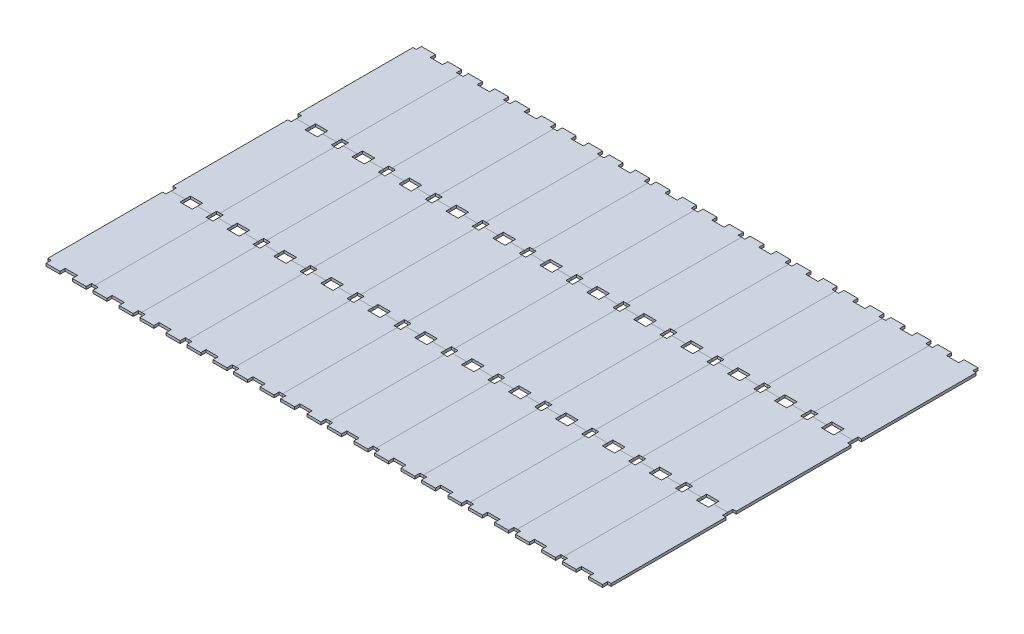
from build123d import *

# Parameters (mm, degrees)
SKETCH1_W           = 57.15
SKETCH1_H           = 152.4
BOSS_EXTRUDE1_DEPTH = 3.175
SKETCH2_W           = 4.07
SKETCH2_H           = 6.35
SKETCH2_W_2         = 14.99
CUT_EXTRUDE1_DEPTH  = 82.443546399
LPATTERN1_COUNT     = 12
LPATTERN1_PITCH     = 57.15
LPATTERN1_2_COUNT   = 3
LPATTERN1_2_PITCH   = 152.4


with BuildPart() as part:
    # Sketch1 → Boss-Extrude1 (new body)
    with BuildSketch(Plane(origin=(0, 0, 0), x_dir=(1, 0, 0), z_dir=(0, 1, 0))):
        Rectangle(SKETCH1_W, SKETCH1_H)
    extrude(amount=BOSS_EXTRUDE1_DEPTH)

    # Sketch2 → Cut-Extrude1 (cut, through all)
    with BuildSketch(Plane(origin=(0, 3.175, 0), x_dir=(1, 0, 0), z_dir=(0, 1, 0))):
        with Locations((-26.54, -73.025)):
            Rectangle(SKETCH2_W, SKETCH2_H)
        with Locations((26.54, -73.025)):
            Rectangle(SKETCH2_W, SKETCH2_H)
        with Locations((0, -73.025)):
            Rectangle(SKETCH2_W_2, SKETCH2_H)
    cut_extrude1 = extrude(amount=-CUT_EXTRUDE1_DEPTH, mode=Mode.SUBTRACT)

    # Mirror1: Cut-Extrude1 across plane
    add(cut_extrude1.mirror(Plane.XY), mode=Mode.SUBTRACT)


with BuildPart() as lpattern1_1:
    # LPattern1: pattern copy
    add(part.part.moved(Location(Vector(1, 0, 0) * (1 * LPATTERN1_PITCH))))


with BuildPart() as lpattern1_2:
    # LPattern1: pattern copy
    add(part.part.moved(Location(Vector(1, 0, 0) * (2 * LPATTERN1_PITCH))))


with BuildPart() as lpattern1_3:
    # LPattern1: pattern copy
    add(part.part.moved(Location(Vector(1, 0, 0) * (3 * LPATTERN1_PITCH))))


with BuildPart() as lpattern1_4:
    # LPattern1: pattern copy
    add(part.part.moved(Location(Vector(1, 0, 0) * (4 * LPATTERN1_PITCH))))


with BuildPart() as lpattern1_5:
    # LPattern1: pattern copy
    add(part.part.moved(Location(Vector(1, 0, 0) * (5 * LPATTERN1_PITCH))))


with BuildPart() as lpattern1_6:
    # LPattern1: pattern copy
    add(part.part.moved(Location(Vector(1, 0, 0) * (6 * LPATTERN1_PITCH))))


with BuildPart() as lpattern1_7:
    # LPattern1: pattern copy
    add(part.part.moved(Location(Vector(1, 0, 0) * (7 * LPATTERN1_PITCH))))


with BuildPart() as lpattern1_8:
    # LPattern1: pattern copy
    add(part.part.moved(Location(Vector(1, 0, 0) * (8 * LPATTERN1_PITCH))))


with BuildPart() as lpattern1_9:
    # LPattern1: pattern copy
    add(part.part.moved(Location(Vector(1, 0, 0) * (9 * LPATTERN1_PITCH))))


with BuildPart() as lpattern1_10:
    # LPattern1: pattern copy
    add(part.part.moved(Location(Vector(1, 0, 0) * (10 * LPATTERN1_PITCH))))


with BuildPart() as lpattern1_11:
    # LPattern1: pattern copy
    add(part.part.moved(Location(Vector(1, 0, 0) * (11 * LPATTERN1_PITCH))))


with BuildPart() as lpattern1_2_1:
    # LPattern1 2: pattern copy
    add(part.part.moved(Location(Vector(0, 0, 1) * (1 * LPATTERN1_2_PITCH))))


with BuildPart() as lpattern1_2_2:
    # LPattern1 2: pattern copy
    add(part.part.moved(Location(Vector(0, 0, 1) * (2 * LPATTERN1_2_PITCH))))


with BuildPart() as lpattern1_2_3:
    # LPattern1 2: pattern copy
    add(lpattern1_1.part.moved(Location(Vector(0, 0, 1) * (1 * LPATTERN1_2_PITCH))))


with BuildPart() as lpattern1_2_4:
    # LPattern1 2: pattern copy
    add(lpattern1_1.part.moved(Location(Vector(0, 0, 1) * (2 * LPATTERN1_2_PITCH))))


with BuildPart() as lpattern1_2_5:
    # LPattern1 2: pattern copy
    add(lpattern1_2.part.moved(Location(Vector(0, 0, 1) * (1 * LPATTERN1_2_PITCH))))


with BuildPart() as lpattern1_2_6:
    # LPattern1 2: pattern copy
    add(lpattern1_2.part.moved(Location(Vector(0, 0, 1) * (2 * LPATTERN1_2_PITCH))))


with BuildPart() as lpattern1_2_7:
    # LPattern1 2: pattern copy
    add(lpattern1_3.part.moved(Location(Vector(0, 0, 1) * (1 * LPATTERN1_2_PITCH))))


with BuildPart() as lpattern1_2_8:
    # LPattern1 2: pattern copy
    add(lpattern1_3.part.moved(Location(Vector(0, 0, 1) * (2 * LPATTERN1_2_PITCH))))


with BuildPart() as lpattern1_2_9:
    # LPattern1 2: pattern copy
    add(lpattern1_4.part.moved(Location(Vector(0, 0, 1) * (1 * LPATTERN1_2_PITCH))))


with BuildPart() as lpattern1_2_10:
    # LPattern1 2: pattern copy
    add(lpattern1_4.part.moved(Location(Vector(0, 0, 1) * (2 * LPATTERN1_2_PITCH))))


with BuildPart() as lpattern1_2_11:
    # LPattern1 2: pattern copy
    add(lpattern1_5.part.moved(Location(Vector(0, 0, 1) * (1 * LPATTERN1_2_PITCH))))


with BuildPart() as lpattern1_2_12:
    # LPattern1 2: pattern copy
    add(lpattern1_5.part.moved(Location(Vector(0, 0, 1) * (2 * LPATTERN1_2_PITCH))))


with BuildPart() as lpattern1_2_13:
    # LPattern1 2: pattern copy
    add(lpattern1_6.part.moved(Location(Vector(0, 0, 1) * (1 * LPATTERN1_2_PITCH))))


with BuildPart() as lpattern1_2_14:
    # LPattern1 2: pattern copy
    add(lpattern1_6.part.moved(Location(Vector(0, 0, 1) * (2 * LPATTERN1_2_PITCH))))


with BuildPart() as lpattern1_2_15:
    # LPattern1 2: pattern copy
    add(lpattern1_7.part.moved(Location(Vector(0, 0, 1) * (1 * LPATTERN1_2_PITCH))))


with BuildPart() as lpattern1_2_16:
    # LPattern1 2: pattern copy
    add(lpattern1_7.part.moved(Location(Vector(0, 0, 1) * (2 * LPATTERN1_2_PITCH))))


with BuildPart() as lpattern1_2_17:
    # LPattern1 2: pattern copy
    add(lpattern1_8.part.moved(Location(Vector(0, 0, 1) * (1 * LPATTERN1_2_PITCH))))


with BuildPart() as lpattern1_2_18:
    # LPattern1 2: pattern copy
    add(lpattern1_8.part.moved(Location(Vector(0, 0, 1) * (2 * LPATTERN1_2_PITCH))))


with BuildPart() as lpattern1_2_19:
    # LPattern1 2: pattern copy
    add(lpattern1_9.part.moved(Location(Vector(0, 0, 1) * (1 * LPATTERN1_2_PITCH))))


with BuildPart() as lpattern1_2_20:
    # LPattern1 2: pattern copy
    add(lpattern1_9.part.moved(Location(Vector(0, 0, 1) * (2 * LPATTERN1_2_PITCH))))


with BuildPart() as lpattern1_2_21:
    # LPattern1 2: pattern copy
    add(lpattern1_10.part.moved(Location(Vector(0, 0, 1) * (1 * LPATTERN1_2_PITCH))))


with BuildPart() as lpattern1_2_22:
    # LPattern1 2: pattern copy
    add(lpattern1_10.part.moved(Location(Vector(0, 0, 1) * (2 * LPATTERN1_2_PITCH))))


with BuildPart() as lpattern1_2_23:
    # LPattern1 2: pattern copy
    add(lpattern1_11.part.moved(Location(Vector(0, 0, 1) * (1 * LPATTERN1_2_PITCH))))


with BuildPart() as lpattern1_2_24:
    # LPattern1 2: pattern copy
    add(lpattern1_11.part.moved(Location(Vector(0, 0, 1) * (2 * LPATTERN1_2_PITCH))))


solid = Compound([part.part, lpattern1_1.part, lpattern1_2.part, lpattern1_3.part, lpattern1_4.part, lpattern1_5.part, lpattern1_6.part, lpattern1_7.part, lpattern1_8.part, lpattern1_9.part, lpattern1_10.part, lpattern1_11.part, lpattern1_2_1.part, lpattern1_2_2.part, lpattern1_2_3.part, lpattern1_2_4.part, lpattern1_2_5.part, lpattern1_2_6.part, lpattern1_2_7.part, lpattern1_2_8.part, lpattern1_2_9.part, lpattern1_2_10.part, lpattern1_2_11.part, lpattern1_2_12.part, lpattern1_2_13.part, lpattern1_2_14.part, lpattern1_2_15.part, lpattern1_2_16.part, lpattern1_2_17.part, lpattern1_2_18.part, lpattern1_2_19.part, lpattern1_2_20.part, lpattern1_2_21.part, lpattern1_2_22.part, lpattern1_2_23.part, lpattern1_2_24.part])
